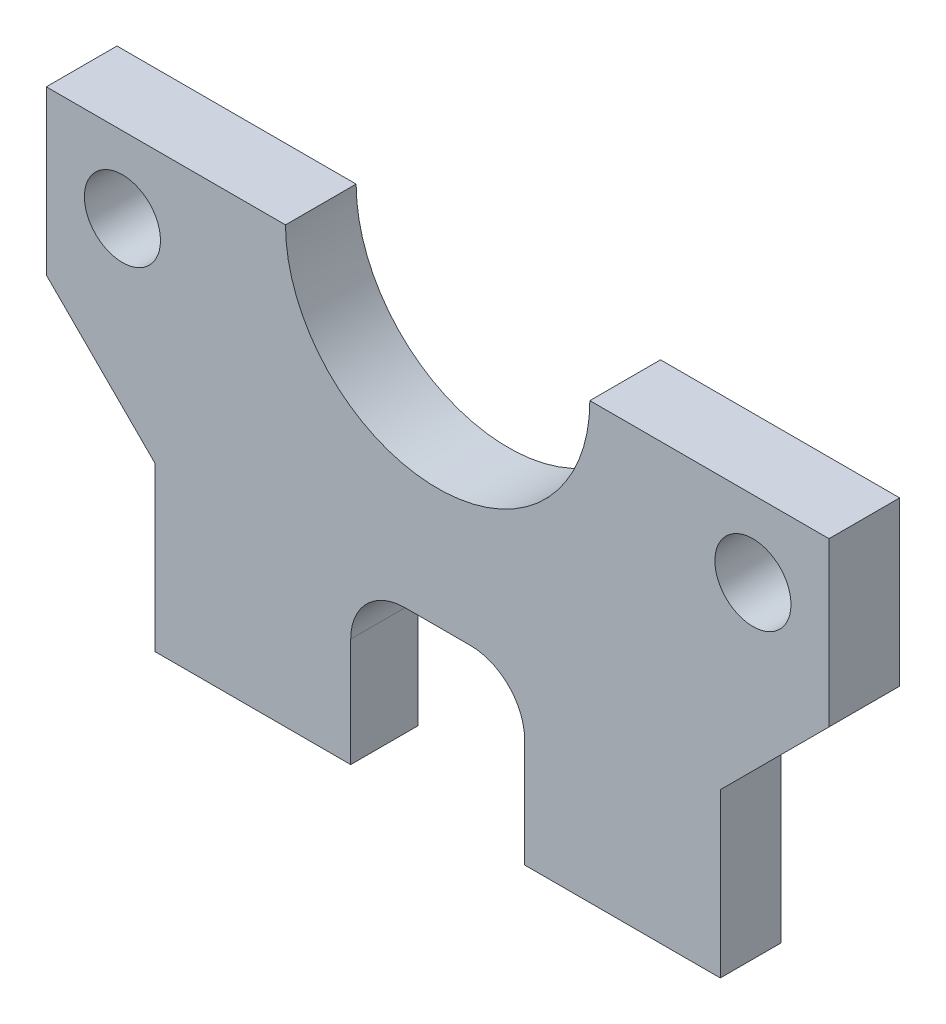
from build123d import *

# Parameters (mm, degrees)
SKETCH1_W           = 52
SKETCH1_H           = 40
BOSS_EXTRUDE1_DEPTH = 6.5
SKETCH16_W          = 10
SKETCH16_H          = 15
BOSS_EXTRUDE2_DEPTH = 6.5
CHAMFER1_SIZE       = 10
CUT_EXTRUDE4_DEPTH  = 25
SKETCH6_R           = 14
CUT_EXTRUDE5_DEPTH  = 10
SKETCH7_R           = 3.5
CUT_EXTRUDE6_DEPTH  = 10
CUT_EXTRUDE8_DEPTH  = 1
SKETCH15_W          = 16
SKETCH15_H          = 15
CUT_EXTRUDE9_DEPTH  = 10
FILLET1_R           = 5
CUT_EXTRUDE10_DEPTH = 25


with BuildPart() as part:
    # Sketch1 → Boss-Extrude1 (new body)
    with BuildSketch(Plane.XY):
        Rectangle(SKETCH1_W, SKETCH1_H)
    extrude(amount=BOSS_EXTRUDE1_DEPTH)

    # Sketch16 → Boss-Extrude2 (add)
    with BuildSketch(Plane(origin=(0, 0, 0), x_dir=(-1, 0, 0), z_dir=(0, 0, -1))):
        with Locations((31, 12.5)):
            Rectangle(SKETCH16_W, SKETCH16_H)
        with Locations((-31, 12.5)):
            Rectangle(SKETCH16_W, SKETCH16_H)
    extrude(amount=-BOSS_EXTRUDE2_DEPTH)

    # Chamfer1
    chamfer1_edges = [part.edges().sort_by_distance(p)[0] for p in [
        (26, 5, 3.25),
        (-26, 5, 3.25),
    ]]
    chamfer(chamfer1_edges, length=CHAMFER1_SIZE - 0.0001)  # a hair under: the kernel refuses the full size

    # Sketch5 → Cut-Extrude4 (cut)
    with BuildSketch(Plane.XZ.offset(20)):
        Polygon((26, 0), (26, 0.925820442), (-26, 0), align=None)
    extrude(amount=-CUT_EXTRUDE4_DEPTH, mode=Mode.SUBTRACT)

    # Sketch6 → Cut-Extrude5 (cut)
    with BuildSketch(Plane.XY.offset(6.5)):
        with Locations((0, 20)):
            Circle(SKETCH6_R)
    extrude(amount=-CUT_EXTRUDE5_DEPTH, mode=Mode.SUBTRACT)

    # Sketch7 → Cut-Extrude6 (cut)
    with BuildSketch(Plane.XY.offset(6.5)):
        with Locations((29, 13)):
            Circle(SKETCH7_R)
        with Locations((-29, 13)):
            Circle(SKETCH7_R)
    extrude(amount=-CUT_EXTRUDE6_DEPTH, mode=Mode.SUBTRACT)

    # Sketch14 → Cut-Extrude8 (cut)
    # profile 1 of 4: a face of its own
    with BuildSketch(Plane.XZ.offset(20)):
        Polygon((-24.051282051, 5), (-23.737179487, 5), (-23.737179487, 1.858974359), (-22.391025641, 1.858974359), (-22.391025641, 1.5), (-24.051282051, 1.5), align=None)
    # profile 2 of 4: a face of its own
    with BuildSketch(Plane.XZ.offset(20)):
        with BuildLine():
            Line((-19.798277244, 2.307692308), (-19.519230769, 2.161157853))
            add(Edge.make_bspline(
                [(-19.519230769, 2.161157853), (-19.541467364, 2.121714521), (-19.584730973, 2.044973418), (-19.659131721, 1.939541558), (-19.737123793, 1.844693842), (-19.822227761, 1.762964188), (-19.91189744, 1.691712803), (-20.006630095, 1.629374978), (-20.106918913, 1.576256458), (-20.212768638, 1.53150393), (-20.325068189, 1.497094436), (-20.444089705, 1.472790215), (-20.570061201, 1.457766946), (-20.65640738, 1.456021806), (-20.700620994, 1.455128205)],
                knots=[0, 0, 0, 0, 1.120438281, 2.179929193, 3.190490725, 4.156257408, 5.095198341, 6.022838206, 6.959905092, 7.901321166, 8.864066838, 9.862729781, 10.905609505, 12, 12, 12, 12], degree=3))
            add(Edge.make_bspline(
                [(-20.700620994, 1.455128205), (-20.749762971, 1.45627538), (-20.845624733, 1.458513187), (-20.98516448, 1.477805652), (-21.116543898, 1.50927801), (-21.239755602, 1.553243552), (-21.354497854, 1.610670876), (-21.460998709, 1.680630358), (-21.559818235, 1.762762612), (-21.647842444, 1.857779056), (-21.727086327, 1.959461013), (-21.797012147, 2.065416898), (-21.855469578, 2.175380122), (-21.903022188, 2.288650646), (-21.941427053, 2.40451454), (-21.968193757, 2.524026007), (-21.983623505, 2.646861592), (-21.98598795, 2.729958927), (-21.987179487, 2.771834936)],
                knots=[0, 0, 0, 0, 1.145258523, 2.234067595, 3.276747158, 4.290159414, 5.277019952, 6.260822364, 7.254936242, 8.264827045, 9.274100331, 10.257902744, 11.220704747, 12.172965371, 13.118907548, 14.062713208, 15.023725156, 16, 16, 16, 16], degree=3))
            add(Edge.make_bspline(
                [(-21.987179487, 2.771834936), (-21.986120346, 2.811129766), (-21.984021268, 2.889006931), (-21.97079048, 3.004272476), (-21.947342187, 3.116300928), (-21.915165863, 3.225185376), (-21.873614617, 3.33074351), (-21.822782398, 3.433039574), (-21.76259002, 3.531964713), (-21.716117346, 3.594367847), (-21.692708333, 3.625801282)],
                knots=[0, 0, 0, 0, 1.024358464, 2.0301432, 3.019427413, 4.004406732, 4.986367066, 5.972626655, 6.978780325, 8, 8, 8, 8], degree=3))
            add(Edge.make_bspline(
                [(-21.692708333, 3.625801282), (-21.661000651, 3.663670152), (-21.598589704, 3.738208303), (-21.493033349, 3.836146628), (-21.378733152, 3.918190404), (-21.257121526, 3.98619754), (-21.126785052, 4.037871187), (-20.989475761, 4.076378769), (-20.843630175, 4.09795678), (-20.743924954, 4.101004614), (-20.692908654, 4.102564103)],
                knots=[0, 0, 0, 0, 1.030682036, 2.02871468, 2.997146059, 3.962720338, 4.930598197, 5.918074684, 6.934738563, 8, 8, 8, 8], degree=3))
            add(Edge.make_bspline(
                [(-20.692908654, 4.102564103), (-20.640461049, 4.101210054), (-20.537570803, 4.098553718), (-20.387538682, 4.073927385), (-20.245577965, 4.03487483), (-20.111745461, 3.97972104), (-19.9860276, 3.908561488), (-19.86924155, 3.820419647), (-19.759390038, 3.718001559), (-19.695481459, 3.63923835), (-19.662960737, 3.599158654)],
                knots=[0, 0, 0, 0, 1.056321875, 2.072262726, 3.055038591, 4.01806755, 4.982017516, 5.957941055, 6.960871419, 8, 8, 8, 8], degree=3))
            add(Edge.make_bspline(
                [(-19.662960737, 3.599158654), (-19.640833799, 3.568955072), (-19.596727206, 3.508748954), (-19.541480106, 3.410577797), (-19.493522711, 3.307867202), (-19.45518975, 3.198956905), (-19.424150249, 3.085137325), (-19.40169343, 2.96559478), (-19.388523811, 2.840364869), (-19.385935114, 2.755038314), (-19.384615385, 2.711538462)],
                knots=[0, 0, 0, 0, 0.94817472, 1.890038105, 2.849395472, 3.817997239, 4.812318967, 5.836947057, 6.897266129, 8, 8, 8, 8], degree=3))
            Line((-19.384615385, 2.711538462), (-21.673076923, 2.711538462))
            add(Edge.make_bspline(
                [(-21.673076923, 2.711538462), (-21.671537317, 2.677837997), (-21.668509743, 2.611567394), (-21.6543946, 2.51459661), (-21.632145826, 2.422223268), (-21.600876763, 2.335140226), (-21.563009918, 2.252210099), (-21.516624201, 2.174048062), (-21.461284647, 2.101010132), (-21.399558948, 2.032442994), (-21.330851852, 1.971382233), (-21.258569105, 1.916730457), (-21.18167554, 1.87092486), (-21.100777457, 1.83374497), (-21.016005672, 1.804638654), (-20.927333476, 1.784770834), (-20.83493536, 1.771463727), (-20.771949626, 1.769984061), (-20.739883814, 1.769230769)],
                knots=[0, 0, 0, 0, 1.094153842, 2.151609401, 3.174256925, 4.172055639, 5.149267565, 6.128595816, 7.11444997, 8.118368179, 9.117203808, 10.09244225, 11.054858984, 12.015122123, 12.976791628, 13.957293641, 14.960065497, 16, 16, 16, 16], degree=3))
            add(Edge.make_bspline(
                [(-20.739883814, 1.769230769), (-20.708532666, 1.769838826), (-20.646325976, 1.771045327), (-20.553685118, 1.782777238), (-20.462545591, 1.801747513), (-20.373284608, 1.827637504), (-20.287713762, 1.859214356), (-20.208468212, 1.897317213), (-20.135587996, 1.93946696), (-20.067471029, 1.987676635), (-20.001400036, 2.046684822), (-19.93585755, 2.120320543), (-19.865580896, 2.207408071), (-19.821591303, 2.272953737), (-19.798277244, 2.307692308)],
                knots=[0, 0, 0, 0, 0.99110716, 1.966546729, 2.947904876, 3.932708344, 4.903319531, 5.828989031, 6.710028674, 7.56322171, 8.463672341, 9.504779593, 10.677557249, 12, 12, 12, 12], degree=3))
        make_face()
        with BuildLine():
            add(Edge.make_bspline(
                [(-19.698717949, 3.025641026), (-19.710214573, 3.067303899), (-19.732341875, 3.14749152), (-19.778578239, 3.25853241), (-19.83064978, 3.357220311), (-19.892271511, 3.442799944), (-19.962090237, 3.518803457), (-20.04273542, 3.585222043), (-20.133171313, 3.644639494), (-20.232930454, 3.694791993), (-20.338572239, 3.737481852), (-20.449178431, 3.766106968), (-20.562036219, 3.78571651), (-20.638370505, 3.787542618), (-20.676782853, 3.788461538)],
                knots=[0, 0, 0, 0, 1.154881502, 2.222775134, 3.210006277, 4.132804581, 5.035138423, 5.962687519, 6.919655026, 7.923214229, 8.944639381, 9.960483929, 10.97369054, 12, 12, 12, 12], degree=3))
            add(Edge.make_bspline(
                [(-20.676782853, 3.788461538), (-20.708132291, 3.787849867), (-20.77010354, 3.786640721), (-20.861404608, 3.775170592), (-20.949084307, 3.756210747), (-21.033789595, 3.73024579), (-21.114410463, 3.695637188), (-21.192605231, 3.655053961), (-21.266385628, 3.605512377), (-21.312526923, 3.567753522), (-21.33583734, 3.548677885)],
                knots=[0, 0, 0, 0, 1.04873581, 2.073130211, 3.073294108, 4.04793562, 5.032784715, 6.005352987, 6.992311501, 8, 8, 8, 8], degree=3))
            add(Edge.make_bspline(
                [(-21.33583734, 3.548677885), (-21.352530622, 3.533583569), (-21.386313756, 3.503036353), (-21.431454277, 3.450407146), (-21.47467475, 3.393655584), (-21.514008403, 3.33061046), (-21.550085989, 3.261989681), (-21.583845967, 3.188372045), (-21.614232379, 3.109198915), (-21.631328489, 3.054026476), (-21.640124199, 3.025641026)],
                knots=[0, 0, 0, 0, 0.879870761, 1.780643979, 2.707998968, 3.669668524, 4.684282772, 5.740141944, 6.837334558, 8, 8, 8, 8], degree=3))
            Line((-21.640124199, 3.025641026), (-19.698717949, 3.025641026))
        make_face(mode=Mode.SUBTRACT)
    # profile 3 of 4: a face of its own
    with BuildSketch(Plane.XZ.offset(20)):
        with BuildLine():
            Line((-17.679487179, 5.068709936), (-17.679487179, 4.741987179))
            add(Edge.make_bspline(
                [(-17.679487179, 4.741987179), (-17.709225959, 4.753938052), (-17.76567078, 4.776621056), (-17.848911156, 4.801285681), (-17.925439989, 4.817221421), (-17.97459388, 4.819457366), (-17.997796474, 4.820512821)],
                knots=[0, 0, 0, 0, 1.16548392, 2.212112691, 3.15604595, 4, 4, 4, 4], degree=3))
            add(Edge.make_bspline(
                [(-17.997796474, 4.820512821), (-18.013470238, 4.81986148), (-18.043809418, 4.818600703), (-18.087412744, 4.812172427), (-18.126701954, 4.799069626), (-18.161607575, 4.78204035), (-18.190558035, 4.760686166), (-18.215344259, 4.739230902), (-18.233310788, 4.715045722), (-18.243065736, 4.692525311), (-18.249015737, 4.671674318), (-18.250805865, 4.650320052), (-18.255190779, 4.624095966), (-18.256413586, 4.591932248), (-18.259200955, 4.554829537), (-18.258954313, 4.512002641), (-18.261238236, 4.464125498), (-18.260896322, 4.430224949), (-18.260717147, 4.412459936)],
                knots=[0, 0, 0, 0, 1.311993654, 2.539582093, 3.670788641, 4.763509788, 5.772417512, 6.671800701, 7.496729179, 8.266799162, 8.712543678, 9.304149002, 10.05334463, 10.934920737, 11.99209668, 13.165090968, 14.514413552, 16, 16, 16, 16], degree=3))
            Line((-18.260717147, 4.412459936), (-18.260717147, 4.057692308))
            Line((-18.260717147, 4.057692308), (-17.724358974, 4.057692308))
            Line((-17.724358974, 4.057692308), (-17.724358974, 3.743589744))
            Line((-17.724358974, 3.743589744), (-18.261418269, 3.743589744))
            Line((-18.261418269, 3.743589744), (-18.262820513, 1.5))
            Line((-18.262820513, 1.5), (-18.576923077, 1.5))
            Line((-18.576923077, 1.5), (-18.576923077, 3.743589744))
            Line((-18.576923077, 3.743589744), (-18.935897436, 3.743589744))
            Line((-18.935897436, 3.743589744), (-18.935897436, 4.057692308))
            Line((-18.935897436, 4.057692308), (-18.576923077, 4.057692308))
            Line((-18.576923077, 4.057692308), (-18.576923077, 4.466446314))
            add(Edge.make_bspline(
                [(-18.576923077, 4.466446314), (-18.576897863, 4.489121894), (-18.576849491, 4.532622798), (-18.57346164, 4.595232239), (-18.57056592, 4.653055703), (-18.564798292, 4.705644336), (-18.558136586, 4.753490479), (-18.548600427, 4.79588336), (-18.539589056, 4.833965119), (-18.523240463, 4.877067776), (-18.498818244, 4.9259178), (-18.459288048, 4.9775417), (-18.41189504, 5.023846647), (-18.355286717, 5.062854), (-18.291571181, 5.095269478), (-18.220690003, 5.118511331), (-18.143414806, 5.131651776), (-18.089927336, 5.133605985), (-18.062299679, 5.134615385)],
                knots=[0, 0, 0, 0, 1.116398763, 2.141702935, 3.087165306, 3.966655413, 4.746276475, 5.464069668, 6.106083417, 6.67047701, 7.730773247, 8.782666744, 9.856985883, 10.980834087, 12.154321827, 13.366232824, 14.639591414, 16, 16, 16, 16], degree=3))
            add(Edge.make_bspline(
                [(-18.062299679, 5.134615385), (-18.034222921, 5.133658004), (-17.975277257, 5.131648034), (-17.883080654, 5.119214627), (-17.783484137, 5.097743597), (-17.715148216, 5.078665712), (-17.679487179, 5.068709936)],
                knots=[0, 0, 0, 0, 0.864728408, 1.815451418, 2.859995356, 4, 4, 4, 4], degree=3))
        make_face()
    # profile 4 of 4: a face of its own
    with BuildSketch(Plane.XZ.offset(20)):
        Polygon((-16.916666667, 5.08974359), (-16.602564103, 5.08974359), (-16.602564103, 4.057692308), (-16.153846154, 4.057692308), (-16.153846154, 3.743589744), (-16.602564103, 3.743589744), (-16.602564103, 1.5), (-16.916666667, 1.5), (-16.916666667, 3.743589744), (-17.365384615, 3.743589744), (-17.365384615, 4.057692308), (-16.916666667, 4.057692308), align=None)
    extrude(amount=-CUT_EXTRUDE8_DEPTH, mode=Mode.SUBTRACT)

    # Sketch15 → Cut-Extrude9 (cut)
    with BuildSketch(Plane.XY.offset(6.5)):
        with Locations((0, -12.5)):
            Rectangle(SKETCH15_W, SKETCH15_H)
    extrude(amount=-CUT_EXTRUDE9_DEPTH, mode=Mode.SUBTRACT)

    # Fillet1
    fillet1_edges = [part.edges().sort_by_distance(p)[0] for p in [
        (8, -5, 3.552672068),
        (-8, -5, 3.410238153),
    ]]
    fillet(fillet1_edges, radius=FILLET1_R)

    # Sketch17 → Cut-Extrude10 (cut)
    with BuildSketch(Plane.XZ.offset(20)):
        Polygon((26, 0.925820442), (36, 1.103862835), (36, 0), (26, 0), align=None)
    extrude(amount=-CUT_EXTRUDE10_DEPTH, mode=Mode.SUBTRACT)


solid = part.part
